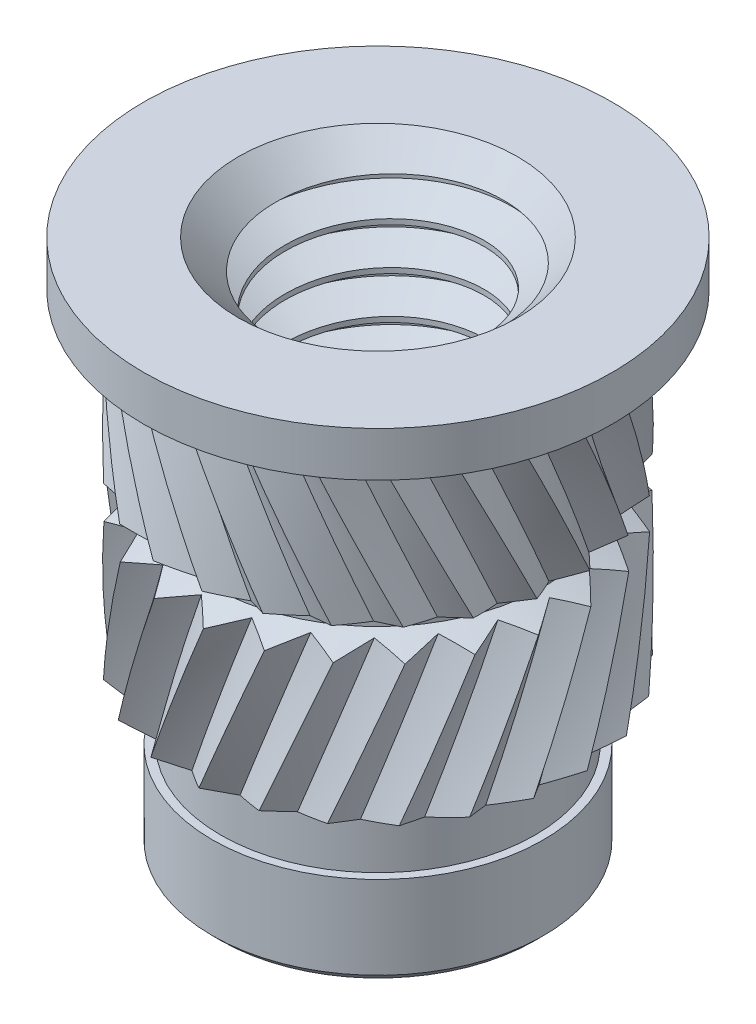
from build123d import *

# Parameters (mm, degrees)
SKETCH4_W         = 1.5
SKETCH4_H         = 6.2704
CUT_SWEEP1_PITCH  = 0.5
SKETCH9_W         = 1.65
SKETCH9_H         = 6.2704
CUT_SWEEP2_PITCH  = 30.768544
CUT_SWEEP3_PITCH  = 36.73856
CIRPATTERN1_COUNT = 24


with BuildPart() as part:
    # Sketch3 → Revolve1 (revolve)
    with BuildSketch(Plane.XY, mode=Mode.PRIVATE) as revolve1_sk:
        Polygon((-2.7686, 3.4002), (-2.7686, 2.8702), (-1.9558, 2.8702), (-1.9558, 2.654935), (-2.3622, 2.654935), (-2.3622, 1.0547985), (-1.9558, 0.88128515), (-1.9558, 0.79778185), (-2.3622, 0.6242685), (-2.3622, -0.975868), (-1.85801, -1.191133), (-1.85801, -1.7910048), (-1.9558, -1.7910048), (-1.9558, -2.77241), (-1.85801, -2.8702), (-1.65, -2.8702), (-1.5, -2.7202), (-1.5, 3.2502), (-1.65, 3.4002), align=None)
    revolve(revolve1_sk.sketch.rotate(Axis((0, 3.4002, 0), (0, -1, 0)), 270), axis=Axis((0, 3.4002, 0), (0, -1, 0)))

    # Sketch9 → Revolve5 (revolve)
    with BuildSketch(Plane.XY):
        with Locations((-0.825, 0.265)):
            Rectangle(SKETCH9_W, SKETCH9_H)
    revolve(axis=Axis((0, 3.4002, 0), (0, -1, 0)))


with BuildPart() as body_2:
    # Sketch4 → Revolve2 (revolve)
    with BuildSketch(Plane.XY):
        with Locations((-0.75, 0.265)):
            Rectangle(SKETCH4_W, SKETCH4_H)
    revolve(axis=Axis((0, 3.4002, 0), (0, -1, 0)))

    # Cut-Sweep1: the profile of Sketch6 screwed along a left-hand helix of 13.5408 turns, 6 arcs to a turn; built about Z, then put on its axis
    cut_sweep1_z = Axis((0, 0, 0), (0, 0, 1))
    cut_sweep1_corners = [(1.175240474, 0, -0.1875), (1.175240474, 0, -0.25), (1.527063294, 0, -0.453125), (1.554126588, 0, 0.03125)]
    with BuildLine(mode=Mode.PRIVATE) as cut_sweep1_profile:
        Line(cut_sweep1_corners[0], cut_sweep1_corners[1])
        Line(cut_sweep1_corners[1], cut_sweep1_corners[2])
        Line(cut_sweep1_corners[2], cut_sweep1_corners[3])
        Line(cut_sweep1_corners[3], cut_sweep1_corners[0])
    cut_sweep1_cap = Face(cut_sweep1_profile.wire())
    cut_sweep1_turn_angles = [0, -30, -60, -90, -120, -150, -180, -210, -240, -270, -300, -330, -360]
    cut_sweep1_turn_weights = [1, 0.8660254037844387, 1, 0.8660254037844387, 1, 0.8660254037844387, 1, 0.8660254037844387, 1, 0.8660254037844387, 1, 0.8660254037844387, 1]
    cut_sweep1_turn_rails = [Edge.make_bspline([Vector(p[0], p[1], 0).rotate(cut_sweep1_z, cut_sweep1_turn_angles[k]) / cut_sweep1_turn_weights[k] + Vector(0, 0, p[2] + -CUT_SWEEP1_PITCH * cut_sweep1_turn_angles[k] / 360) for k in range(13)], [0, 0, 0, 1, 1, 2, 2, 3, 3, 4, 4, 5, 5, 6, 6, 6], 2, cut_sweep1_turn_weights) for p in cut_sweep1_corners]
    cut_sweep1_turn_sides = [Face.make_surface_from_curves(cut_sweep1_turn_rails[p[0]], cut_sweep1_turn_rails[p[1]]) for p in [(0, 1), (1, 2), (2, 3), (3, 0)]]
    cut_sweep1_last_angles = [-4680, -4710, -4740, -4770, -4800, -4830, -4860, -4867.344, -4874.688]
    cut_sweep1_last_weights = [1, 0.8660254037844387, 1, 0.8660254037844387, 1, 0.8660254037844387, 1, 0.9917965715056192, 1]
    cut_sweep1_last_rails = [Edge.make_bspline([Vector(p[0], p[1], 0).rotate(cut_sweep1_z, cut_sweep1_last_angles[k]) / cut_sweep1_last_weights[k] + Vector(0, 0, p[2] + -CUT_SWEEP1_PITCH * cut_sweep1_last_angles[k] / 360) for k in range(9)], [0, 0, 0, 1, 1, 2, 2, 3, 3, 4, 4, 4], 2, cut_sweep1_last_weights) for p in cut_sweep1_corners]
    cut_sweep1_last_sides = [Face.make_surface_from_curves(cut_sweep1_last_rails[p[0]], cut_sweep1_last_rails[p[1]]) for p in [(0, 1), (1, 2), (2, 3), (3, 0)]]
    cut_sweep1 = Plane(origin=(0, -2.8702, 0), x_dir=(1, 0, 0), z_dir=(0, 1, 0)) * Solid(Shell([*[p.moved(Location((0, 0, CUT_SWEEP1_PITCH * i))) for i in range(13) for p in cut_sweep1_turn_sides], *cut_sweep1_last_sides, cut_sweep1_cap, cut_sweep1_cap.rotate(cut_sweep1_z, -4874.688).moved(Location((0, 0, -CUT_SWEEP1_PITCH * -4874.688 / 360)))]))
    add(cut_sweep1, mode=Mode.SUBTRACT)

    # Sketch7 → Revolve3 (revolve)
    with BuildSketch(Plane.XY, mode=Mode.PRIVATE) as revolve3_sk:
        Polygon((-1.65, -2.8702), (0, -1.2202), (0, -2.8702), align=None)
    revolve(revolve3_sk.sketch.rotate(Axis((0, -1.2202, 0), (0, -1, 0)), 243.25631605), axis=Axis((0, -1.2202, 0), (0, -1, 0)))

    # Sketch8 → Revolve4 (revolve)
    with BuildSketch(Plane.XY):
        Polygon((-1.65, 3.4002), (0, 3.4002), (0, 1.7502), align=None)
    revolve(axis=Axis((0, 3.4002, 0), (0, -1, 0)))


with BuildPart() as part_1:
    add(part.part)

    # Combine1: cut body 2
    add(body_2.part, mode=Mode.SUBTRACT)

    # Cut-Sweep2: the profile of Sketch12 screwed along a left-hand helix of 0.0625 turns, 22 arcs to a turn; built about Z, then put on its axis
    cut_sweep2_z = Axis((0, 0, 0), (0, 0, 1))
    cut_sweep2_corners = [(2.0574, 0, 0), (2.416458774, 0.480663535, 0), (2.416458774, -0.480663535, 0)]
    with BuildLine(mode=Mode.PRIVATE) as cut_sweep2_profile:
        Line(cut_sweep2_corners[0], cut_sweep2_corners[1])
        Line(cut_sweep2_corners[2], cut_sweep2_corners[0])
        ThreePointArc((2.416458774, 0.480663535, 0), (2.4638, 0, 0), (2.416458774, -0.480663535, 0))
    cut_sweep2_cap = Face(cut_sweep2_profile.wire())
    cut_sweep2_arcs = [((2.416458774, 0.480663535, 0), (2.512068696, 0, 0), (2.416458774, -0.480663535, 0), (1, 0.9807852804032305, 1))]  # start, shoulder, end, weights
    cut_sweep2_turn_angles = [0, -8.181818182, -16.363636364, -19.431818182, -22.5]
    cut_sweep2_turn_weights = [1, 0.9898214418809327, 1, 0.9985665480507289, 1]
    cut_sweep2_turn_rails = [Edge.make_bspline([Vector(p[0], p[1], 0).rotate(cut_sweep2_z, cut_sweep2_turn_angles[k]) / cut_sweep2_turn_weights[k] + Vector(0, 0, p[2] + -CUT_SWEEP2_PITCH * cut_sweep2_turn_angles[k] / 360) for k in range(5)], [0, 0, 0, 1, 1, 2, 2, 2], 2, cut_sweep2_turn_weights) for p in cut_sweep2_corners]
    cut_sweep2_turn_sides = [*[Face.make_surface_from_curves(cut_sweep2_turn_rails[p[0]], cut_sweep2_turn_rails[p[1]]) for p in [(0, 1), (2, 0)]], *[Face.make_bezier_surface([[Vector(p[j][0], p[j][1], 0).rotate(cut_sweep2_z, cut_sweep2_turn_angles[2 * i + k]) / cut_sweep2_turn_weights[2 * i + k] + Vector(0, 0, p[j][2] + -CUT_SWEEP2_PITCH * cut_sweep2_turn_angles[2 * i + k] / 360) for k in range(3)] for j in range(3)], [[p[3][j] * cut_sweep2_turn_weights[2 * i + k] for k in range(3)] for j in range(3)]) for p in cut_sweep2_arcs for i in range(2)]]
    cut_sweep2 = Plane(origin=(0, 0.8395335, 0), x_dir=(1, 0, 0), z_dir=(0, 1, 0)) * Solid(Shell([*cut_sweep2_turn_sides, cut_sweep2_cap, cut_sweep2_cap.rotate(cut_sweep2_z, -22.5).moved(Location((0, 0, -CUT_SWEEP2_PITCH * -22.5 / 360)))]))
    add(cut_sweep2, mode=Mode.SUBTRACT)

    # Cut-Sweep3: the profile of Sketch13 screwed along a right-hand helix of 0.0625 turns, 24 arcs to a turn; built about Z, then put on its axis
    cut_sweep3_z = Axis((0, 0, 0), (0, 0, 1))
    cut_sweep3_corners = [(2.0574, 0, 0), (2.416458774, -0.480663535, 0), (2.416458774, 0.480663535, 0)]
    with BuildLine(mode=Mode.PRIVATE) as cut_sweep3_profile:
        Line(cut_sweep3_corners[0], cut_sweep3_corners[1])
        Line(cut_sweep3_corners[2], cut_sweep3_corners[0])
        ThreePointArc((2.416458774, -0.480663535, 0), (2.4638, 0, 0), (2.416458774, 0.480663535, 0))
    cut_sweep3_cap = Face(cut_sweep3_profile.wire())
    cut_sweep3_arcs = [((2.416458774, -0.480663535, 0), (2.512068696, 0, 0), (2.416458774, 0.480663535, 0), (1, 0.9807852804032305, 1))]  # start, shoulder, end, weights
    cut_sweep3_turn_angles = [0, 7.5, 15, 18.75, 22.5]
    cut_sweep3_turn_weights = [1, 0.9914448613738104, 1, 0.9978589232386035, 1]
    cut_sweep3_turn_rails = [Edge.make_bspline([Vector(p[0], p[1], 0).rotate(cut_sweep3_z, cut_sweep3_turn_angles[k]) / cut_sweep3_turn_weights[k] + Vector(0, 0, p[2] + CUT_SWEEP3_PITCH * cut_sweep3_turn_angles[k] / 360) for k in range(5)], [0, 0, 0, 1, 1, 2, 2, 2], 2, cut_sweep3_turn_weights) for p in cut_sweep3_corners]
    cut_sweep3_turn_sides = [*[Face.make_surface_from_curves(cut_sweep3_turn_rails[p[0]], cut_sweep3_turn_rails[p[1]]) for p in [(0, 1), (2, 0)]], *[Face.make_bezier_surface([[Vector(p[j][0], p[j][1], 0).rotate(cut_sweep3_z, cut_sweep3_turn_angles[2 * i + k]) / cut_sweep3_turn_weights[2 * i + k] + Vector(0, 0, p[j][2] + CUT_SWEEP3_PITCH * cut_sweep3_turn_angles[2 * i + k] / 360) for k in range(3)] for j in range(3)], [[p[3][j] * cut_sweep3_turn_weights[2 * i + k] for k in range(3)] for j in range(3)]) for p in cut_sweep3_arcs for i in range(2)]]
    cut_sweep3 = Plane(origin=(0, 0.8395335, 0), x_dir=(1, 0, 0), z_dir=(0, -1, 0)) * Solid(Shell([*cut_sweep3_turn_sides, cut_sweep3_cap, cut_sweep3_cap.rotate(cut_sweep3_z, 22.5).moved(Location((0, 0, CUT_SWEEP3_PITCH * 22.5 / 360)))]))
    add(cut_sweep3, mode=Mode.SUBTRACT)

    # CirPattern1: Cut-Sweep2, Cut-Sweep3 ×24 about axis
    cirpattern1_axis = Axis((0, -2.8702, 0), (0, 1, 0))
    add([cut_sweep2.rotate(cirpattern1_axis, i * 360 / CIRPATTERN1_COUNT) for i in range(1, CIRPATTERN1_COUNT)], mode=Mode.SUBTRACT)
    add([cut_sweep3.rotate(cirpattern1_axis, i * 360 / CIRPATTERN1_COUNT) for i in range(1, CIRPATTERN1_COUNT)], mode=Mode.SUBTRACT)


solid = part_1.part
